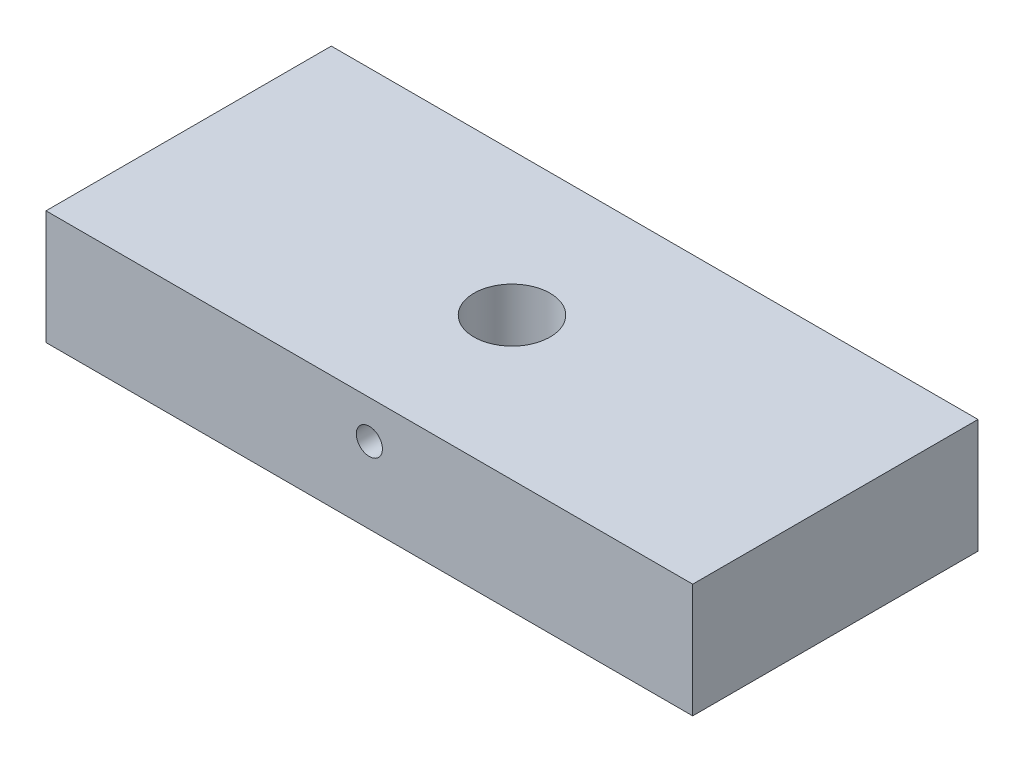
from build123d import *

# Parameters (mm, degrees)
SKETCH1_W           = 68
SKETCH1_H           = 30
BOSS_EXTRUDE1_DEPTH = 12
SKETCH2_R           = 11
CUT_EXTRUDE1_DEPTH  = 4
SKETCH3_R           = 4
CUT_EXTRUDE2_DEPTH  = 39.013155617
CUT_EXTRUDE3_REACH  = 48.904
SKETCH4_R           = 1.375


with BuildPart() as part:
    # Sketch1 → Boss-Extrude1 (new body)
    with BuildSketch(Plane(origin=(0, 0, 0), x_dir=(1, 0, 0), z_dir=(0, 1, 0))):
        Rectangle(SKETCH1_W, SKETCH1_H)
    extrude(amount=BOSS_EXTRUDE1_DEPTH)

    # Sketch2 → Cut-Extrude1 (cut)
    with BuildSketch(Plane.XZ):
        Circle(SKETCH2_R)
    extrude(amount=-CUT_EXTRUDE1_DEPTH, mode=Mode.SUBTRACT)

    # Sketch3 → Cut-Extrude2 (cut, through all)
    with BuildSketch(Plane.XZ.offset(-4)):
        Circle(SKETCH3_R)
    extrude(amount=-CUT_EXTRUDE2_DEPTH, mode=Mode.SUBTRACT)

    # Sketch4 → Cut-Extrude3 (cut, up to next)
    with BuildSketch(Plane.XY.offset(15), mode=Mode.PRIVATE) as cut_extrude3_sk1:
        with Locations((0, 8)):
            Circle(SKETCH4_R)
    cut_extrude3_tool1 = extrude(cut_extrude3_sk1.sketch, amount=-CUT_EXTRUDE3_REACH, mode=Mode.PRIVATE) & part.part
    add(cut_extrude3_tool1.solids().sort_by_distance((0, 8, 15))[0], mode=Mode.SUBTRACT)


solid = part.part
